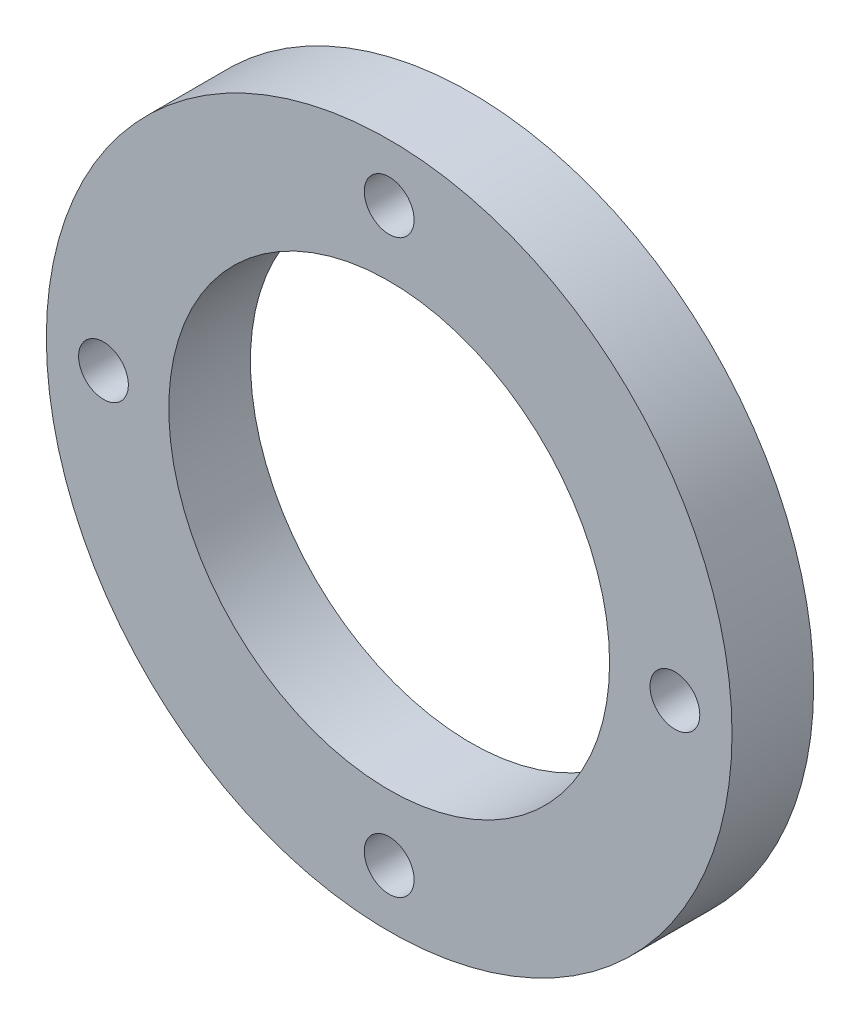
from build123d import *

# Parameters (mm, degrees)
SKETCH1_R           = 21
SKETCH1_R_2         = 13
SKETCH1_R_3         = 1.5
BOSS_EXTRUDE1_DEPTH = 5
SKETCH2_R           = 13.5
CUT_EXTRUDE1_DEPTH  = 10
SKETCH3_R           = 1.525
CUT_EXTRUDE2_DEPTH  = 10


with BuildPart() as part:
    # Sketch1 → Boss-Extrude1 (new body)
    with BuildSketch(Plane.XY):
        with Locations((49, 5)):
            Circle(SKETCH1_R)
        with Locations((49, 5)):
            Circle(SKETCH1_R_2, mode=Mode.SUBTRACT)
        with Locations((31.5, 5)):
            Circle(SKETCH1_R_3, mode=Mode.SUBTRACT)
        with Locations((49, 22.5)):
            Circle(SKETCH1_R_3, mode=Mode.SUBTRACT)
        with Locations((66.5, 5)):
            Circle(SKETCH1_R_3, mode=Mode.SUBTRACT)
        with Locations((49, -12.5)):
            Circle(SKETCH1_R_3, mode=Mode.SUBTRACT)
    extrude(amount=BOSS_EXTRUDE1_DEPTH)

    # Sketch2 → Cut-Extrude1 (cut)
    with BuildSketch(Plane.XY.offset(5)):
        with Locations((49, 5)):
            Circle(SKETCH2_R)
    extrude(amount=-CUT_EXTRUDE1_DEPTH, mode=Mode.SUBTRACT)

    # Sketch3 → Cut-Extrude2 (cut)
    with BuildSketch(Plane.XY.offset(5)):
        with Locations((49, 22.5)):
            Circle(SKETCH3_R)
        with Locations((31.5, 5)):
            Circle(SKETCH3_R)
        with Locations((66.5, 5)):
            Circle(SKETCH3_R)
        with Locations((49, -12.5)):
            Circle(SKETCH3_R)
    extrude(amount=-CUT_EXTRUDE2_DEPTH, mode=Mode.SUBTRACT)


solid = part.part
